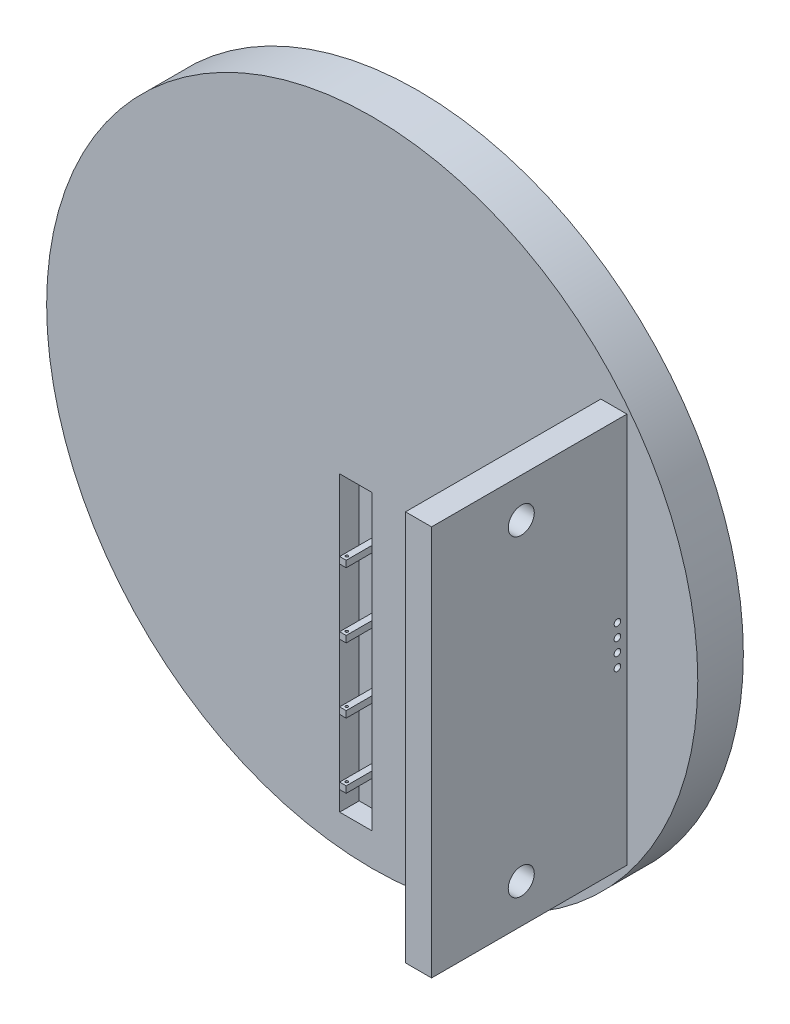
from build123d import *

# Parameters (mm, degrees)
SKETCH2_R           = 25
BOSS_EXTRUDE1_DEPTH = 2.5
SKETCH4_W           = 2.5
SKETCH4_H           = 2.726925283
CUT_EXTRUDE1_DEPTH  = 22.5
SKETCH8_W           = 1
SKETCH8_H           = 1
SKETCH8_W_2         = 2
SKETCH9_W           = 0.5
SKETCH9_H           = 0.5
BOSS_EXTRUDE3_DEPTH = 3.5
SKETCH10_R          = 0.1
CUT_EXTRUDE2_DEPTH  = 17.5
SKETCH11_W          = 2
SKETCH11_H          = 30
BOSS_EXTRUDE4_DEPTH = 15
SKETCH12_R          = 1
SKETCH12_R_2        = 0.25
CUT_EXTRUDE3_DEPTH  = 15


with BuildPart() as part:
    # Sketch2 → Boss-Extrude1 (new body)
    with BuildSketch(Plane(origin=(0, 0, 0), x_dir=(0, 1, 0), z_dir=(0, 0, 1))):
        Circle(SKETCH2_R)
    extrude(amount=BOSS_EXTRUDE1_DEPTH)

    # Sketch4 → Cut-Extrude1 (cut)
    with BuildSketch(Plane(origin=(0, 0, 0), x_dir=(-1, 0, 0), z_dir=(0, 1, 0))):
        with Locations((1.25, 2.363462641)):
            Rectangle(SKETCH4_W, SKETCH4_H)
    extrude(amount=-CUT_EXTRUDE1_DEPTH, mode=Mode.SUBTRACT)

    # Sketch8 → Revolve2 (revolve)
    with BuildSketch(Plane.YZ):
        with Locations((2.5, -0.5)):
            Rectangle(SKETCH8_W, SKETCH8_H)
        with Locations((4.5, -0.5)):
            Rectangle(SKETCH8_W, SKETCH8_H)
        with Locations((6.5, -0.5)):
            Rectangle(SKETCH8_W, SKETCH8_H)
        with Locations((8.5, -0.5)):
            Rectangle(SKETCH8_W, SKETCH8_H)
        with Locations((24, -0.5)):
            Rectangle(SKETCH8_W_2, SKETCH8_H)
    revolve(axis=Axis((0, 0, 0), (0, 0, 1)))

    # Sketch9 → Boss-Extrude3 (add)
    with BuildSketch(Plane(origin=(0, 0, 0), x_dir=(0, 1, 0), z_dir=(0, 0, 1))):
        with Locations((-4.75, 1.25)):
            Rectangle(SKETCH9_W, SKETCH9_H)
        with Locations((-9.75, 1.25)):
            Rectangle(SKETCH9_W, SKETCH9_H)
        with Locations((-14.75, 1.25)):
            Rectangle(SKETCH9_W, SKETCH9_H)
        with Locations((-19.75, 1.25)):
            Rectangle(SKETCH9_W, SKETCH9_H)
    extrude(amount=BOSS_EXTRUDE3_DEPTH)

    # Sketch10 → Cut-Extrude2 (cut)
    with BuildSketch(Plane.XZ.offset(20)):
        with Locations((-1.25, 3.202014363)):
            Circle(SKETCH10_R)
    extrude(amount=-CUT_EXTRUDE2_DEPTH, mode=Mode.SUBTRACT)

    # Sketch11 → Boss-Extrude4 (add)
    with BuildSketch(Plane.XY.offset(2.5)):
        with Locations((18.558520072, 0)):
            Rectangle(SKETCH11_W, SKETCH11_H)
    extrude(amount=BOSS_EXTRUDE4_DEPTH)

    # Sketch12 → Cut-Extrude3 (cut)
    with BuildSketch(Plane.YZ.offset(19.558520072)):
        with Locations((12, 10.613168665)):
            Circle(SKETCH12_R)
        with Locations((-12, 10.613168665)):
            Circle(SKETCH12_R)
        with Locations((0.5, 3.229684711)):
            Circle(SKETCH12_R_2)
        with Locations((1.5, 3.229684711)):
            Circle(SKETCH12_R_2)
        with Locations((-1.5, 3.229684711)):
            Circle(SKETCH12_R_2)
        with Locations((-0.5, 3.229684711)):
            Circle(SKETCH12_R_2)
    extrude(amount=-CUT_EXTRUDE3_DEPTH, mode=Mode.SUBTRACT)


solid = part.part
